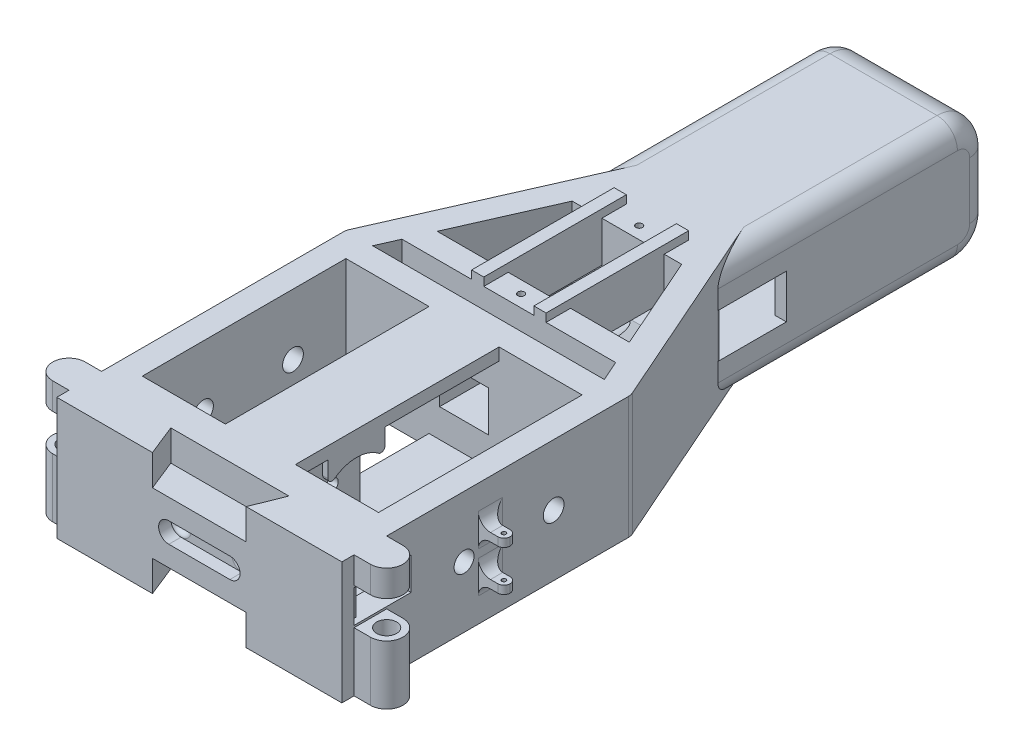
from build123d import *

# Parameters (mm, degrees)
SKETCH1_W             = 58
SKETCH1_H             = 65
BOSS_EXTRUDE1_DEPTH   = 30
BOSS_EXTRUDE3_REACH   = 92.09
SKETCH10_W            = 5
SKETCH10_H            = 14
CUT_EXTRUDE1_REACH    = 111.372
SKETCH2_R             = 2.45
SKETCH2_R_2           = 2.55
CUT_EXTRUDE2_REACH    = 91.744
SKETCH3_W             = 12
SKETCH3_H             = 10
SKETCH11_W            = 3
SKETCH11_H            = 2
BOSS_EXTRUDE4_DEPTH   = 6.3
FILLET3_R             = 1.5
SKETCH12_R            = 0.5
CUT_EXTRUDE3_DEPTH    = 92.15338732
FILLET3_OF_MIRROR1_R  = 1.5
BOSS_EXTRUDE5_REACH   = 111.564
SKETCH13_W            = 15
SKETCH13_H            = 6
BOSS_EXTRUDE6_REACH   = 111.564
SKETCH17_W            = 15
SKETCH17_H            = 14
CUT_EXTRUDE18_REACH   = 129.651
SKETCH35_W            = 16
SKETCH35_H            = 6
FILLET5_R             = 3
BOSS_EXTRUDE7_START   = 20
BOSS_EXTRUDE7_DEPTH   = 10
BOSS_EXTRUDE8_DEPTH   = 20
CUT_EXTRUDE15_REACH   = 95.637
SKETCH28_R            = 0.8
FILLET4_R             = 3
CUT_EXTRUDE16_REACH   = 96.767
SKETCH29_R            = 1.6
SKETCH30_W            = 14
SKETCH30_H            = 1.5
BOSS_EXTRUDE9_DEPTH   = 6.1
SKETCH31_W            = 1.3
SKETCH31_H            = 14
BOSS_EXTRUDE10_DEPTH  = 5
CUT_EXTRUDE17_REACH   = 99.736
FILLET11_R            = 1
FILLET11_OF_MIRROR4_R = 1
MIRROR5_START         = 2.5
MIRROR5_OUTLINE_W     = 1.5
MIRROR5_OUTLINE_H     = 14
MIRROR5_DEPTH         = 6.1
MIRROR5_START_2       = 7.3
MIRROR5_2_DEPTH       = 1.3
SKETCH36_W            = 22
SKETCH36_H            = 15
BOSS_EXTRUDE12_DEPTH  = 14
CUT_EXTRUDE19_DEPTH   = 3
CUT_EXTRUDE20_DEPTH   = 11
CUT_EXTRUDE21_REACH   = 100.983
SKETCH41_W            = 3
SKETCH41_H            = 35
BOSS_EXTRUDE13_DEPTH  = 2
BOSS_EXTRUDE14_START  = -1.789079
SKETCH43_W            = 36.284482562
SKETCH43_H            = 9.6
BOSS_EXTRUDE14_DEPTH  = 66.789079
BOSS_EXTRUDE15_REACH  = 152.996
SKETCH44_W            = 2.842240903
SKETCH44_H            = 50
FILLET6_R             = 8
FILLET7_R             = 5
SKETCH45_W            = 17
SKETCH45_H            = 8
CUT_EXTRUDE22_DEPTH   = 166.644015889
BOSS_EXTRUDE16_REACH  = 152.29
SKETCH46_W            = 4.5
SKETCH46_H            = 5
BOSS_EXTRUDE17_START  = -30
BOSS_EXTRUDE17_DEPTH  = 30
SKETCH49_W            = 8
SKETCH49_H            = 9
CUT_EXTRUDE23_DEPTH   = 8
SKETCH50_R            = 2.45
CUT_EXTRUDE24_DEPTH   = 4.5
CUT_EXTRUDE25_START   = 13.5
SKETCH51_R            = 2.45
CUT_EXTRUDE25_DEPTH   = 4.5
BOSS_EXTRUDE18_REACH  = 165.708
SKETCH53_W            = 5
SKETCH53_H            = 10
SKETCH55_W            = 58
SKETCH55_H            = 10
BOSS_EXTRUDE20_DEPTH  = 4
CUT_EXTRUDE9_START    = -10
SKETCH19_W            = 30
SKETCH19_H            = 15
CUT_EXTRUDE9_DEPTH    = 10
SKETCH58_W            = 70
SKETCH58_H            = 9
CUT_EXTRUDE27_DEPTH   = 153.77843439
BOSS_EXTRUDE22_REACH  = 153.411
SKETCH59_W            = 30
SKETCH59_H            = 5
CUT_EXTRUDE28_REACH   = 183.113
SKETCH18_R            = 1.5
FILLET9_R             = 2
FILLET10_R            = 1
SKETCH60_W            = 70
SKETCH60_H            = 3
BOSS_EXTRUDE23_DEPTH  = 30
CUT_EXTRUDE29_DEPTH   = 7.5
CUT_EXTRUDE30_DEPTH   = 3
SKETCH64_W            = 58
SKETCH64_H            = 4
BOSS_EXTRUDE24_DEPTH  = 6
CUT_EXTRUDE31_DEPTH   = 7.5


# Read off the part's stored shape, not the designer's step: Mirror5
# Some blends are built 0.0001 mm under size
with BuildPart() as part:
    # Sketch1 → Boss-Extrude1 (new body)
    with BuildSketch(Plane(origin=(0, 0, 0), x_dir=(1, 0, 0), z_dir=(0, 1, 0))):
        Polygon((-35, 38.5), (-17.352941176, 78.5), (17.352941947, 78.5), (35, 38.5), (35, -38.5), (-35, -38.5), align=None)
        Rectangle(SKETCH1_W, SKETCH1_H, mode=Mode.SUBTRACT)
        Polygon((-28.44203382, 38.5), (28.442033867, 38.5), (13.442034522, 72.5), (-13.44203382, 72.5), align=None, mode=Mode.SUBTRACT)
    extrude(amount=BOSS_EXTRUDE1_DEPTH)

    # Sketch7 → Loft3 section 0
    with BuildSketch(Plane.XY.offset(-32.5)):
        with BuildLine():
            Line((-8.6, 30), (8.6, 30))
            Line((8.6, 30), (8.6, 27))
            Line((8.6, 27), (-8.6, 27))
            Line((-8.6, 27), (-8.6, 30))
        make_face()
    # Sketch8 → Loft3 section 1
    with BuildSketch(Plane.XY.offset(38.5)):
        with BuildLine():
            Line((-8.6, 30), (8.6, 30))
            Line((8.6, 30), (8.6, 27))
            Line((8.6, 27), (-8.6, 27))
            Line((-8.6, 27), (-8.6, 30))
        make_face()
    loft3 = loft()

    # Mirror3: Loft3 across plane
    add(loft3.mirror(Plane(origin=(0, 15, 0), x_dir=(0, 0, 1), z_dir=(0, -1, 0))))

    # Sketch10 → Boss-Extrude3 (add, up to next)
    with BuildSketch(Plane.XZ.offset(-27), mode=Mode.PRIVATE) as boss_extrude3_sk1:
        with Locations((0, 2.5)):
            Rectangle(SKETCH10_W, SKETCH10_H)
    boss_extrude3_tool1 = extrude(boss_extrude3_sk1.sketch, amount=BOSS_EXTRUDE3_REACH, mode=Mode.PRIVATE) - part.part
    add(boss_extrude3_tool1.solids().sort_by_distance((0, 27, 2.5))[0])

    # Sketch2 → Cut-Extrude1 (cut, up to next)
    with BuildSketch(Plane(origin=(35, 0, 0), x_dir=(0, 0, -1), z_dir=(1, 0, 0)), mode=Mode.PRIVATE) as cut_extrude1_sk1:
        with Locations((-2.5, 15)):
            Circle(SKETCH2_R)
    cut_extrude1_tool1 = extrude(cut_extrude1_sk1.sketch, amount=-CUT_EXTRUDE1_REACH, mode=Mode.PRIVATE) & part.part
    # Sketch2 → Cut-Extrude1 (cut, up to next)
    with BuildSketch(Plane(origin=(35, 0, 0), x_dir=(0, 0, -1), z_dir=(1, 0, 0)), mode=Mode.PRIVATE) as cut_extrude1_sk2:
        with Locations((19.5, 15)):
            Circle(SKETCH2_R_2)
    cut_extrude1_tool2 = extrude(cut_extrude1_sk2.sketch, amount=-CUT_EXTRUDE1_REACH, mode=Mode.PRIVATE) & part.part
    cut_extrude1_1 = cut_extrude1_tool1.solids().sort_by_distance((35, 15, 2.5))[0]
    add(cut_extrude1_1, mode=Mode.SUBTRACT)
    cut_extrude1_2 = cut_extrude1_tool2.solids().sort_by_distance((35, 15, -19.5))[0]
    add(cut_extrude1_2, mode=Mode.SUBTRACT)
    cut_extrude1 = cut_extrude1_1 + cut_extrude1_2  # Cut-Extrude1 as one shape, for the pattern or mirror that repeats it

    # Sketch3 → Cut-Extrude2 (cut, up to next)
    with BuildSketch(Plane(origin=(0, 0, -38.5), x_dir=(-1, 0, 0), z_dir=(0, 0, -1)), mode=Mode.PRIVATE) as cut_extrude2_sk1:
        with Locations((0, 15)):
            Rectangle(SKETCH3_W, SKETCH3_H)
    cut_extrude2_tool1 = extrude(cut_extrude2_sk1.sketch, amount=-CUT_EXTRUDE2_REACH, mode=Mode.PRIVATE) & part.part
    add(cut_extrude2_tool1.solids().sort_by_distance((0, 15, -38.5))[0], mode=Mode.SUBTRACT)

    # Sketch11 → Boss-Extrude4 (add)
    with BuildSketch(Plane(origin=(35, 0, 0), x_dir=(0, 0, -1), z_dir=(1, 0, 0))):
        with Locations((2.5, 20)):
            Rectangle(SKETCH11_W, SKETCH11_H)
        with Locations((2.5, 10)):
            Rectangle(SKETCH11_W, SKETCH11_H)
    boss_extrude4 = extrude(amount=BOSS_EXTRUDE4_DEPTH)

    # Fillet3
    fillet3_edges = [part.edges().sort_by_distance(p)[0] for p in [
        (41.3, 10, -1),
        (41.3, 10, -4),
        (41.3, 20, -1),
        (41.3, 20, -4),
    ]]
    fillet(fillet3_edges, radius=FILLET3_R - 0.0001)  # a hair under: the kernel refuses the full size

    # Sketch12 → Cut-Extrude3 (cut, through all)
    with BuildSketch(Plane(origin=(0, 21, 0), x_dir=(1, 0, 0), z_dir=(0, 1, 0))):
        with Locations(Location((39.8, 2.5, 0), (0, 0, 270))):
            Circle(SKETCH12_R)
    cut_extrude3 = extrude(amount=-CUT_EXTRUDE3_DEPTH, mode=Mode.SUBTRACT)

    # Mirror1: Cut-Extrude1, Boss-Extrude4, Cut-Extrude3 across plane
    add(cut_extrude1.mirror(Plane(origin=(0, 0, 0), x_dir=(0, 0, 1), z_dir=(1, 0, 0))), mode=Mode.SUBTRACT)
    add(boss_extrude4.mirror(Plane(origin=(0, 0, 0), x_dir=(0, 0, 1), z_dir=(1, 0, 0))))
    add(cut_extrude3.mirror(Plane(origin=(0, 0, 0), x_dir=(0, 0, 1), z_dir=(1, 0, 0))), mode=Mode.SUBTRACT)

    # Fillet3 of Mirror1
    fillet3_of_mirror1_edges = [part.edges().sort_by_distance(p)[0] for p in [
        (-41.3, 10, -1),
        (-41.3, 10, -4),
        (-41.3, 20, -1),
        (-41.3, 20, -4),
    ]]
    fillet(fillet3_of_mirror1_edges, radius=FILLET3_OF_MIRROR1_R - 0.0001)  # a hair under: the kernel refuses the full size

    # Sketch13 → Boss-Extrude5 (add, up to next)
    with BuildSketch(Plane(origin=(-29, 0, 0), x_dir=(0, 0, -1), z_dir=(1, 0, 0)), mode=Mode.PRIVATE) as boss_extrude5_sk1:
        with Locations((-25, 27)):
            Rectangle(SKETCH13_W, SKETCH13_H)
    boss_extrude5_tool1 = extrude(boss_extrude5_sk1.sketch, amount=BOSS_EXTRUDE5_REACH, mode=Mode.PRIVATE) - part.part
    add(boss_extrude5_tool1.solids().sort_by_distance((-29, 27, 25))[0])

    # Sketch17 → Boss-Extrude6 (add, up to next)
    with BuildSketch(Plane(origin=(-29, 0, 0), x_dir=(0, 0, -1), z_dir=(1, 0, 0)), mode=Mode.PRIVATE) as boss_extrude6_sk1:
        with Locations((-25, 7)):
            Rectangle(SKETCH17_W, SKETCH17_H)
    boss_extrude6_tool1 = extrude(boss_extrude6_sk1.sketch, amount=BOSS_EXTRUDE6_REACH, mode=Mode.PRIVATE) - part.part
    add(boss_extrude6_tool1.solids().sort_by_distance((-29, 7, 25))[0])

    # Sketch35 → Cut-Extrude18 (cut, up to next)
    with BuildSketch(Plane(origin=(0, 0, -78.5), x_dir=(-1, 0, 0), z_dir=(0, 0, -1)), mode=Mode.PRIVATE) as cut_extrude18_sk1:
        with Locations((0, 15)):
            Rectangle(SKETCH35_W, SKETCH35_H)
    cut_extrude18_tool1 = extrude(cut_extrude18_sk1.sketch, amount=-CUT_EXTRUDE18_REACH, mode=Mode.PRIVATE) & part.part
    add(cut_extrude18_tool1.solids().sort_by_distance((0, 15, -78.5))[0], mode=Mode.SUBTRACT)

    # Fillet5
    fillet5_edges = [part.edges().sort_by_distance(p)[0] for p in [
        (-35, 15, -38.5),
        (-17.352941176, 15, -78.5),
        (17.352941947, 15, -78.5),
        (35, 15, -38.5),
        (-8, 15, -78.5),
        (8, 15, -78.5),
    ]]
    fillet(fillet5_edges, radius=FILLET5_R)

    # Sketch24 → Boss-Extrude7 (add)
    with BuildSketch(Plane(origin=(0, 0, 0), x_dir=(1, 0, 0), z_dir=(0, 1, 0)).offset(BOSS_EXTRUDE7_START)):
        Polygon((9.15, 49.5), (9.15, 72.5), (6.15, 72.5), (6.15, 49.5), (-6.15, 49.5), (-6.15, 72.5), (-9.15, 72.5), (-9.15, 49.5), (-23.589092644, 49.5), (-26.23615161, 43.5), (26.23615161, 43.5), (23.589092902, 49.5), align=None)
    extrude(amount=BOSS_EXTRUDE7_DEPTH)

    # Sketch26 → Boss-Extrude8 (add)
    with BuildSketch(Plane(origin=(0, 0, -38.5), x_dir=(-1, 0, 0), z_dir=(0, 0, -1))):
        Polygon((-11, 5), (-11, 0), (11, 0), (11, 5), (11, 15), (6, 15), (6, 10), (-6, 10), (-6, 15), (-11, 15), align=None)
    extrude(amount=BOSS_EXTRUDE8_DEPTH)

    # Sketch28 → Cut-Extrude15 (cut, up to next)
    with BuildSketch(Plane(origin=(0, 30, 0), x_dir=(-1, 0, 0), z_dir=(0, 1, 0)), mode=Mode.PRIVATE) as cut_extrude15_sk1:
        with Locations(Location((0, -46.5, 0), (0, 0, 90))):
            Circle(SKETCH28_R)
    cut_extrude15_tool1 = extrude(cut_extrude15_sk1.sketch, amount=-CUT_EXTRUDE15_REACH, mode=Mode.PRIVATE) & part.part
    # Sketch28 → Cut-Extrude15 (cut, up to next)
    with BuildSketch(Plane(origin=(0, 30, 0), x_dir=(-1, 0, 0), z_dir=(0, 1, 0)), mode=Mode.PRIVATE) as cut_extrude15_sk2:
        with Locations(Location((0, -75.5, 0), (0, 0, 90))):
            Circle(SKETCH28_R)
    cut_extrude15_tool2 = extrude(cut_extrude15_sk2.sketch, amount=-CUT_EXTRUDE15_REACH, mode=Mode.PRIVATE) & part.part
    add(cut_extrude15_tool1.solids().sort_by_distance((0, 30, -46.5))[0], mode=Mode.SUBTRACT)
    add(cut_extrude15_tool2.solids().sort_by_distance((0, 30, -75.5))[0], mode=Mode.SUBTRACT)

    # Fillet4
    fillet4_edges = [part.edges().sort_by_distance(p)[0] for p in [
        (35, 19, -2.5),
        (35, 20, -4),
        (35, 21, -2.5),
        (35, 11, -2.5),
        (35, 9, -2.5),
        (35, 10, -4),
        (-35, 19, -2.5),
        (-35, 20, -4),
        (-35, 21, -2.5),
        (-35, 11, -2.5),
        (-35, 9, -2.5),
        (-35, 10, -4),
    ]]
    fillet(fillet4_edges, radius=FILLET4_R)

    # Sketch29 → Cut-Extrude16 (cut, up to next)
    with BuildSketch(Plane(origin=(2.5, 0, 0), x_dir=(0, 0, -1), z_dir=(1, 0, 0)), mode=Mode.PRIVATE) as cut_extrude16_sk1:
        with Locations(Location((-2.5, 15, 0), (0, 0, 90))):
            Circle(SKETCH29_R)
    cut_extrude16_tool1 = extrude(cut_extrude16_sk1.sketch, amount=-CUT_EXTRUDE16_REACH, mode=Mode.PRIVATE) & part.part
    add(cut_extrude16_tool1.solids().sort_by_distance((2.5, 15, 2.5))[0], mode=Mode.SUBTRACT)

    # Sketch30 → Boss-Extrude9 (add)
    with BuildSketch(Plane.ZY.offset(2.5)):
        with Locations((2.5, 26.25)):
            Rectangle(SKETCH30_W, SKETCH30_H)
    boss_extrude9 = extrude(amount=BOSS_EXTRUDE9_DEPTH)

    # Sketch31 → Boss-Extrude10 (add)
    with BuildSketch(Plane.XZ.offset(-25.5)):
        with Locations((-7.95, 2.5)):
            Rectangle(SKETCH31_W, SKETCH31_H)
    boss_extrude10 = extrude(amount=BOSS_EXTRUDE10_DEPTH)

    # Sketch32 → Cut-Extrude17 (cut, up to next)
    with BuildSketch(Plane.ZY.offset(8.6), mode=Mode.PRIVATE) as cut_extrude17_sk1:
        with BuildLine():
            Line((-4.5, 20.5), (-4.5, 20.656854249))
            ThreePointArc((-4.5, 20.656854249), (2.5, 24), (9.5, 20.656854249))
            Line((9.5, 20.656854249), (9.5, 20.5))
            Line((9.5, 20.5), (-4.5, 20.5))
        make_face()
    cut_extrude17_tool1 = extrude(cut_extrude17_sk1.sketch, amount=-CUT_EXTRUDE17_REACH, mode=Mode.PRIVATE) & part.part
    cut_extrude17 = cut_extrude17_tool1.solids().sort_by_distance((-8.6, 21.927092, 2.5))[0]
    add(cut_extrude17, mode=Mode.SUBTRACT)

    # Fillet11
    fillet11_edges = [part.edges().sort_by_distance(p)[0] for p in [
        (-7.95, 20.656854249, 9.5),
        (-7.95, 20.656854249, -4.5),
    ]]
    fillet(fillet11_edges, radius=FILLET11_R)

    # Mirror4: Boss-Extrude9, Boss-Extrude10, Cut-Extrude17 across plane
    add(boss_extrude9.mirror(Plane(origin=(0, 15, 0), x_dir=(0, 0, 1), z_dir=(0, -1, 0))))
    add(boss_extrude10.mirror(Plane(origin=(0, 15, 0), x_dir=(0, 0, 1), z_dir=(0, -1, 0))))
    add(cut_extrude17.mirror(Plane(origin=(0, 15, 0), x_dir=(0, 0, 1), z_dir=(0, -1, 0))), mode=Mode.SUBTRACT)

    # Fillet11 of Mirror4
    fillet11_of_mirror4_edges = [part.edges().sort_by_distance(p)[0] for p in [
        (-7.95, 9.343145751, 9.5),
        (-7.95, 9.343145751, -4.5),
    ]]
    fillet(fillet11_of_mirror4_edges, radius=FILLET11_OF_MIRROR4_R)

    # Mirror5 outline → Mirror5 (add)
    with BuildSketch(Plane.YZ.offset(MIRROR5_START)):
        with Locations((3.75, 2.5)):
            Rectangle(MIRROR5_OUTLINE_W, MIRROR5_OUTLINE_H)
        with Locations((26.25, 2.5)):
            Rectangle(MIRROR5_OUTLINE_W, MIRROR5_OUTLINE_H)
    extrude(amount=MIRROR5_DEPTH)

    # Mirror5 2 outline → Mirror5 2 (add)
    with BuildSketch(Plane.YZ.offset(MIRROR5_START_2)):
        with BuildLine():
            Line((7, 9.5), (4.5, 9.5))
            Line((4.5, 9.5), (4.5, -4.5))
            Line((4.5, -4.5), (7, -4.5))
            ThreePointArc((7, -4.5), (7.894427191, -3.947213595), (7.8, -2.9))
            ThreePointArc((7.8, -2.9), (6, 2.5), (7.8, 7.9))
            ThreePointArc((7.8, 7.9), (7.894427191, 8.947213595), (7, 9.5))
        make_face()
        with BuildLine():
            Line((25.5, 9.5), (23, 9.5))
            ThreePointArc((23, 9.5), (22.105572809, 8.947213595), (22.2, 7.9))
            ThreePointArc((22.2, 7.9), (24, 2.5), (22.2, -2.9))
            ThreePointArc((22.2, -2.9), (22.105572809, -3.947213595), (23, -4.5))
            Line((23, -4.5), (25.5, -4.5))
            Line((25.5, -4.5), (25.5, 9.5))
        make_face()
    extrude(amount=MIRROR5_2_DEPTH)

    # Sketch36 → Boss-Extrude12 (add)
    with BuildSketch(Plane(origin=(0, 0, -58.5), x_dir=(-1, 0, 0), z_dir=(0, 0, -1))):
        with Locations((0, 7.5)):
            Rectangle(SKETCH36_W, SKETCH36_H)
    extrude(amount=BOSS_EXTRUDE12_DEPTH)

    # Sketch37 → Cut-Extrude19 (cut)
    with BuildSketch(Plane.XY.offset(-58.5)):
        with BuildLine():
            Line((-6, 15), (6, 15))
            ThreePointArc((6, 15), (5.340169944, 12.204915028), (3.5, 10))
            Line((3.5, 10), (-3.5, 10))
            ThreePointArc((-3.5, 10), (-5.340169944, 12.204915028), (-6, 15))
        make_face()
    extrude(amount=-CUT_EXTRUDE19_DEPTH, mode=Mode.SUBTRACT)

    # Sketch38 → Cut-Extrude20 (cut)
    with BuildSketch(Plane.XY.offset(-61.5)):
        with BuildLine():
            Line((-6, 15), (6, 15))
            ThreePointArc((6, 15), (0, 12), (-6, 15))
        make_face()
    extrude(amount=-CUT_EXTRUDE20_DEPTH, mode=Mode.SUBTRACT)

    # Cut-Extrude21: up to this face of the body (flat: up to its plane)
    cut_extrude21_end = Plane(part.part.faces().sort_by_distance((11, 7.5, -55.5))[0])
    # Sketch40 → Cut-Extrude21 (cut, up to the picked face)
    with BuildSketch(Plane.ZY.offset(11), mode=Mode.PRIVATE) as cut_extrude21_sk1:
        Polygon((-58.5, 15), (-72.5, 15), (-72.5, 12), align=None)
    cut_extrude21_tool1 = split(extrude(cut_extrude21_sk1.sketch, amount=-CUT_EXTRUDE21_REACH, mode=Mode.PRIVATE), bisect_by=cut_extrude21_end, keep=Keep.BOTH, mode=Mode.PRIVATE)
    add(cut_extrude21_tool1.solids().sort_by(Axis((-11, 14, -67.833333), (1, 0, 0)))[0], mode=Mode.SUBTRACT)

    # Sketch41 → Boss-Extrude13 (add)
    with BuildSketch(Plane(origin=(0, 30, 0), x_dir=(1, 0, 0), z_dir=(0, 1, 0))):
        with Locations((-7.65, 61)):
            Rectangle(SKETCH41_W, SKETCH41_H)
        with Locations((7.65, 61)):
            Rectangle(SKETCH41_W, SKETCH41_H)
    extrude(amount=BOSS_EXTRUDE13_DEPTH)

    # Sketch43 → Boss-Extrude14 (add)
    with BuildSketch(Plane(origin=(0, 0, -78.5), x_dir=(-1, 0, 0), z_dir=(0, 0, -1)).offset(BOSS_EXTRUDE14_START)):
        with Locations((-3.78e-07, 4.8)):
            Rectangle(SKETCH43_W, SKETCH43_H)
        with Locations((-3.78e-07, 25.2)):
            Rectangle(SKETCH43_W, SKETCH43_H)
    extrude(amount=BOSS_EXTRUDE14_DEPTH)

    # Sketch44 → Boss-Extrude15 (add, up to next)
    with BuildSketch(Plane(origin=(0, 9.6, 0), x_dir=(1, 0, 0), z_dir=(0, 1, 0)), mode=Mode.PRIVATE) as boss_extrude15_sk1:
        with Locations((-16.721120451, 118.5)):
            Rectangle(SKETCH44_W, SKETCH44_H)
    boss_extrude15_tool1 = extrude(boss_extrude15_sk1.sketch, amount=BOSS_EXTRUDE15_REACH, mode=Mode.PRIVATE) - part.part
    # Sketch44 → Boss-Extrude15 (add, up to next)
    with BuildSketch(Plane(origin=(0, 9.6, 0), x_dir=(1, 0, 0), z_dir=(0, 1, 0)), mode=Mode.PRIVATE) as boss_extrude15_sk2:
        Polygon((18.142241659, 143.5), (15.3, 143.5), (15.3, 93.5), (18.142240903, 93.5), align=None)
    boss_extrude15_tool2 = extrude(boss_extrude15_sk2.sketch, amount=BOSS_EXTRUDE15_REACH, mode=Mode.PRIVATE) - part.part
    add(boss_extrude15_tool1.solids().sort_by_distance((-16.72112, 9.6, -118.5))[0])
    add(boss_extrude15_tool2.solids().sort_by_distance((16.721121, 9.6, -118.500001))[0])

    # Fillet6
    fillet6_edges = [part.edges().sort_by_distance(p)[0] for p in [
        (3.78e-07, 0, -143.5),
        (3.78e-07, 30, -143.5),
    ]]
    fillet(fillet6_edges, radius=FILLET6_R)

    # Fillet7
    # the kernel refuses this fillet: 5 mm, written as the material it takes off along each edge
    with BuildSketch(Plane(origin=(18.142241659, 0, -64.210921), x_dir=(-1, 0, 0), z_dir=(0, 0, -1))) as fillet7_piece_1_section:
        with BuildLine():
            CenterArc((FILLET7_R, FILLET7_R), FILLET7_R, 180, 90)
            Line((0, FILLET7_R), (0, 0))
            Line((0, 0), (FILLET7_R, 0))
        make_face()
    fillet7_piece_1 = extrude(amount=71.289079, mode=Mode.PRIVATE)
    fillet7_piece_1 = split(fillet7_piece_1, bisect_by=Plane(origin=(6.655944686, 1.159648817, -102.746528186), z_dir=(0.9149178080838143, 0, -0.4036401918182936)), keep=Keep.TOP, mode=Mode.PRIVATE)
    with BuildSketch(Plane(origin=(18.142241659, 8, -135.5), x_dir=(0, -1, 0), z_dir=(0, 0, 1))) as fillet7_piece_2:
        with BuildLine():
            CenterArc((8 - FILLET7_R, -FILLET7_R), FILLET7_R, 0, 90)
            Line((8 - FILLET7_R, 0), (8, 0))
            Line((8, 0), (8, -FILLET7_R))
        make_face()
    fillet7_piece_2_solid = revolve(axis=Axis((18.142241659, 8, -135.5), (1, 0, 0)), revolution_arc=90, mode=Mode.PRIVATE)
    with BuildSketch(Plane(origin=(18.142241659, 9.6, -143.5), x_dir=(-1, 0, 0), z_dir=(0, 1, 0))) as fillet7_piece_3:
        with BuildLine():
            CenterArc((FILLET7_R * 1.00000001512, FILLET7_R), FILLET7_R, 179.999999134, 90.000000866)
            Line((FILLET7_R * 1.511713279e-08, FILLET7_R * 1.00000001512), (0, 0))
            Line((0, 0), (FILLET7_R * 1.00000001512, 0))
        make_face()
    fillet7_piece_3_solid = extrude(amount=10.8, mode=Mode.PRIVATE)
    with BuildSketch(Plane(origin=(18.142241659, 22, -135.5), x_dir=(0, 1, 0), z_dir=(0, 0, 1))) as fillet7_piece_4:
        with BuildLine():
            CenterArc((8 - FILLET7_R, FILLET7_R), FILLET7_R, 270, 90)
            Line((8 - FILLET7_R, 0), (8, 0))
            Line((8, 0), (8, FILLET7_R))
        make_face()
    fillet7_piece_4_solid = revolve(axis=Axis((18.142241659, 22, -135.5), (-1, 0, 0)), revolution_arc=90, mode=Mode.PRIVATE)
    with BuildSketch(Plane(origin=(-18.142240903, 0, -64.210921), x_dir=(0, 1, 0), z_dir=(0, 0, -1))) as fillet7_piece_5_section:
        with BuildLine():
            CenterArc((FILLET7_R, FILLET7_R), FILLET7_R, 180, 90)
            Line((0, FILLET7_R), (0, 0))
            Line((0, 0), (FILLET7_R, 0))
        make_face()
    fillet7_piece_5 = extrude(amount=71.289079, mode=Mode.PRIVATE)
    fillet7_piece_5 = split(fillet7_piece_5, bisect_by=Plane(origin=(-6.655943611, 1.159648816, -102.746527816), z_dir=(-0.914917801572932, 0, -0.40364020657629374)), keep=Keep.TOP, mode=Mode.PRIVATE)
    with BuildSketch(Plane(origin=(-18.142240903, 8, -135.5), x_dir=(0, -1, 0), z_dir=(0, 0, 1))) as fillet7_piece_6:
        with BuildLine():
            CenterArc((8 - FILLET7_R, FILLET7_R), FILLET7_R, 270, 90)
            Line((8, FILLET7_R), (8, 0))
            Line((8, 0), (8 - FILLET7_R, 0))
        make_face()
    fillet7_piece_6_solid = revolve(axis=Axis((-18.142240903, 8, -135.5), (1, 0, 0)), revolution_arc=90, mode=Mode.PRIVATE)
    with BuildSketch(Plane(origin=(-18.142240903, 22, -143.5), x_dir=(0, 0, 1), z_dir=(0, -1, 0))) as fillet7_piece_7:
        with BuildLine():
            CenterArc((FILLET7_R, -FILLET7_R), FILLET7_R, 90, 90)
            Line((0, -FILLET7_R), (0, 0))
            Line((0, 0), (FILLET7_R, 0))
        make_face()
    fillet7_piece_7_solid = extrude(amount=14, mode=Mode.PRIVATE)
    with BuildSketch(Plane(origin=(-18.142240903, 22, -135.5), x_dir=(0, 1, 0), z_dir=(0, 0, 1))) as fillet7_piece_8:
        with BuildLine():
            CenterArc((8 - FILLET7_R, -FILLET7_R), FILLET7_R, 0, 90)
            Line((8, -FILLET7_R), (8, 0))
            Line((8, 0), (8 - FILLET7_R, 0))
        make_face()
    fillet7_piece_8_solid = revolve(axis=Axis((-18.142240903, 22, -135.5), (-1, 0, 0)), revolution_arc=90, mode=Mode.PRIVATE)
    with BuildSketch(Plane(origin=(18.142241659, 30, -64.210921), x_dir=(-1, 0, 0), z_dir=(0, 0, -1))) as fillet7_piece_9_section:
        with BuildLine():
            CenterArc((FILLET7_R, -FILLET7_R), FILLET7_R, 90, 90)
            Line((0, -FILLET7_R), (0, 0))
            Line((0, 0), (FILLET7_R, 0))
        make_face()
    fillet7_piece_9 = extrude(amount=71.289079, mode=Mode.PRIVATE)
    fillet7_piece_9 = split(fillet7_piece_9, bisect_by=Plane(origin=(6.655944686, 28.840351183, -102.746528186), z_dir=(0.9149178080838143, 0, -0.4036401918182936)), keep=Keep.TOP, mode=Mode.PRIVATE)
    with BuildSketch(Plane(origin=(-18.142240903, 30, -64.210921), x_dir=(1, 0, 0), z_dir=(0, 0, -1))) as fillet7_piece_10_section:
        with BuildLine():
            CenterArc((FILLET7_R, FILLET7_R), FILLET7_R, 180, 90)
            Line((0, FILLET7_R), (0, 0))
            Line((0, 0), (FILLET7_R, 0))
        make_face()
    fillet7_piece_10 = extrude(amount=71.289079, mode=Mode.PRIVATE)
    fillet7_piece_10 = split(fillet7_piece_10, bisect_by=Plane(origin=(-6.655943611, 28.840351184, -102.746527816), z_dir=(-0.914917801572932, 0, -0.40364020657629374)), keep=Keep.TOP, mode=Mode.PRIVATE)
    with BuildSketch(Plane(origin=(18.142241659, 20.4, -143.5), x_dir=(0, 0, 1), z_dir=(0, 1, 0)), Plane(origin=(18.142241659, 9.6, -143.5), x_dir=(-1, 0, 0), z_dir=(0, -1, 0))) as fillet7_piece_11:
        with BuildLine():
            CenterArc((FILLET7_R, -FILLET7_R), FILLET7_R, 90, 90)
            Line((0, -FILLET7_R), (0, 0))
            Line((0, 0), (FILLET7_R, 0))
        make_face()
    fillet7_piece_11_solid = extrude(amount=1.6, mode=Mode.PRIVATE)
    add([fillet7_piece_1, fillet7_piece_2_solid, fillet7_piece_3_solid, fillet7_piece_4_solid, fillet7_piece_5, fillet7_piece_6_solid, fillet7_piece_7_solid, fillet7_piece_8_solid, fillet7_piece_9, fillet7_piece_10, fillet7_piece_11_solid], mode=Mode.SUBTRACT)

    # Sketch45 → Cut-Extrude22 (cut, through all)
    with BuildSketch(Plane(origin=(35, 0, 0), x_dir=(0, 0, -1), z_dir=(1, 0, 0))):
        with Locations((-24, 19)):
            Rectangle(SKETCH45_W, SKETCH45_H)
    extrude(amount=-CUT_EXTRUDE22_DEPTH, mode=Mode.SUBTRACT)

    # Sketch46 → Boss-Extrude16 (add, up to next)
    with BuildSketch(Plane(origin=(0, 15, 0), x_dir=(1, 0, 0), z_dir=(0, 1, 0)), mode=Mode.PRIVATE) as boss_extrude16_sk1:
        with Locations((31.25, -30)):
            Rectangle(SKETCH46_W, SKETCH46_H)
    boss_extrude16_tool1 = extrude(boss_extrude16_sk1.sketch, amount=BOSS_EXTRUDE16_REACH, mode=Mode.PRIVATE) - part.part
    boss_extrude16 = boss_extrude16_tool1.solids().sort_by_distance((31.25, 15, 30))[0]
    add(boss_extrude16)

    # Sketch48 → Boss-Extrude17 (add)
    with BuildSketch(Plane.XZ.offset(BOSS_EXTRUDE17_START)):
        with BuildLine():
            Line((35, 29.5), (39, 29.5))
            ThreePointArc((39, 29.5), (43, 25.5), (39, 21.5))
            Line((39, 21.5), (35, 21.5))
            Line((35, 21.5), (35, 29.5))
        make_face()
    boss_extrude17 = extrude(amount=BOSS_EXTRUDE17_DEPTH)

    # Sketch49 → Cut-Extrude23 (cut)
    with BuildSketch(Plane.XY.offset(29.5)):
        with Locations((39, 19)):
            Rectangle(SKETCH49_W, SKETCH49_H)
    cut_extrude23 = extrude(amount=-CUT_EXTRUDE23_DEPTH, mode=Mode.SUBTRACT)

    # Sketch50 → Cut-Extrude24 (cut)
    with BuildSketch(Plane(origin=(0, 14.5, 0), x_dir=(1, 0, 0), z_dir=(0, 1, 0))):
        with Locations(Location((39, -25.5, 0), (0, 0, 270))):
            Circle(SKETCH50_R)
    cut_extrude24 = extrude(amount=-CUT_EXTRUDE24_DEPTH, mode=Mode.SUBTRACT)

    # Sketch51 → Cut-Extrude25 (cut)
    with BuildSketch(Plane(origin=(0, 14.5, 0), x_dir=(1, 0, 0), z_dir=(0, 1, 0)).offset(CUT_EXTRUDE25_START)):
        with Locations(Location((39, -25.5, 0), (0, 0, 270))):
            Circle(SKETCH51_R)
    cut_extrude25 = extrude(amount=-CUT_EXTRUDE25_DEPTH, mode=Mode.SUBTRACT)

    # Mirror7: Boss-Extrude16, Boss-Extrude17, Cut-Extrude23, Cut-Extrude24, Cut-Extrude25 across plane
    add(boss_extrude16.mirror(Plane(origin=(0, 0, 0), x_dir=(0, 0, 1), z_dir=(1, 0, 0))))
    add(boss_extrude17.mirror(Plane(origin=(0, 0, 0), x_dir=(0, 0, 1), z_dir=(1, 0, 0))))
    add(cut_extrude23.mirror(Plane(origin=(0, 0, 0), x_dir=(0, 0, 1), z_dir=(1, 0, 0))), mode=Mode.SUBTRACT)
    add(cut_extrude24.mirror(Plane(origin=(0, 0, 0), x_dir=(0, 0, 1), z_dir=(1, 0, 0))), mode=Mode.SUBTRACT)
    add(cut_extrude25.mirror(Plane(origin=(0, 0, 0), x_dir=(0, 0, 1), z_dir=(1, 0, 0))), mode=Mode.SUBTRACT)

    # Sketch53 → Boss-Extrude18 (add, up to next)
    with BuildSketch(Plane.ZY.offset(-29), mode=Mode.PRIVATE) as boss_extrude18_sk1:
        with Locations((30, 19)):
            Rectangle(SKETCH53_W, SKETCH53_H)
    boss_extrude18_tool1 = extrude(boss_extrude18_sk1.sketch, amount=BOSS_EXTRUDE18_REACH, mode=Mode.PRIVATE) - part.part
    add(boss_extrude18_tool1.solids().sort_by_distance((29, 19, 30))[0])

    # Sketch55 → Boss-Extrude20 (add)
    with BuildSketch(Plane(origin=(0, 0, 27.5), x_dir=(-1, 0, 0), z_dir=(0, 0, -1))):
        with Locations((0, 19)):
            Rectangle(SKETCH55_W, SKETCH55_H)
    extrude(amount=BOSS_EXTRUDE20_DEPTH)

    # Sketch19 → Cut-Extrude9 (cut)
    with BuildSketch(Plane(origin=(0, 30, 0), x_dir=(1, 0, 0), z_dir=(0, 1, 0)).offset(CUT_EXTRUDE9_START)):
        with Locations((0, -25)):
            Rectangle(SKETCH19_W, SKETCH19_H)
    extrude(amount=-CUT_EXTRUDE9_DEPTH, mode=Mode.SUBTRACT)

    # Sketch58 → Cut-Extrude27 (cut, through all)
    with BuildSketch(Plane(origin=(0, 30, 0), x_dir=(1, 0, 0), z_dir=(0, 1, 0))):
        with Locations((0, -34)):
            Rectangle(SKETCH58_W, SKETCH58_H)
    extrude(amount=-CUT_EXTRUDE27_DEPTH, mode=Mode.SUBTRACT)

    # Sketch59 → Boss-Extrude22 (add, up to next)
    with BuildSketch(Plane(origin=(0, 10, 0), x_dir=(1, 0, 0), z_dir=(0, 1, 0)), mode=Mode.PRIVATE) as boss_extrude22_sk1:
        with Locations((0, -27)):
            Rectangle(SKETCH59_W, SKETCH59_H)
    boss_extrude22_tool1 = extrude(boss_extrude22_sk1.sketch, amount=BOSS_EXTRUDE22_REACH, mode=Mode.PRIVATE) - part.part
    add(boss_extrude22_tool1.solids().sort_by_distance((0, 10, 27))[0])

    # Sketch18 → Cut-Extrude28 (cut, up to next)
    with BuildSketch(Plane.XY.offset(29.5), mode=Mode.PRIVATE) as cut_extrude28_sk1:
        with Locations((7.5, 15)):
            Circle(SKETCH18_R)
    cut_extrude28_tool1 = extrude(cut_extrude28_sk1.sketch, amount=-CUT_EXTRUDE28_REACH, mode=Mode.PRIVATE) & part.part
    # Sketch18 → Cut-Extrude28 (cut, up to next)
    with BuildSketch(Plane.XY.offset(29.5), mode=Mode.PRIVATE) as cut_extrude28_sk2:
        with Locations((-7.5, 15)):
            Circle(SKETCH18_R)
    cut_extrude28_tool2 = extrude(cut_extrude28_sk2.sketch, amount=-CUT_EXTRUDE28_REACH, mode=Mode.PRIVATE) & part.part
    add(cut_extrude28_tool1.solids().sort_by_distance((7.5, 15, 29.5))[0], mode=Mode.SUBTRACT)
    add(cut_extrude28_tool2.solids().sort_by_distance((-7.5, 15, 29.5))[0], mode=Mode.SUBTRACT)

    # Fillet9
    fillet9_edges = [part.edges().sort_by_distance(p)[0] for p in [
        (6, 15, 24.5),
        (-9, 15, 24.5),
    ]]
    fillet(fillet9_edges, radius=FILLET9_R)

    # Fillet10
    fillet10_edges = [part.edges().sort_by_distance(p)[0] for p in [
        (6, 15, 29.5),
        (-9, 15, 29.5),
    ]]
    fillet(fillet10_edges, radius=FILLET10_R)

    # Sketch60 → Boss-Extrude23 (add)
    with BuildSketch(Plane.XZ):
        with Locations((0, 31)):
            Rectangle(SKETCH60_W, SKETCH60_H)
    extrude(amount=-BOSS_EXTRUDE23_DEPTH)

    # Sketch61 → Cut-Extrude29 (cut)
    with BuildSketch(Plane.XZ):
        Polygon((11.5, 32.5), (-11.5, 32.5), (-14.5, 25), (14.5, 25), align=None)
    extrude(amount=-CUT_EXTRUDE29_DEPTH, mode=Mode.SUBTRACT)

    # Sketch62 → Cut-Extrude30 (cut)
    with BuildSketch(Plane.XY.offset(32.5)):
        with BuildLine():
            Line((-7.5, 17.5), (7.5, 17.5))
            ThreePointArc((7.5, 17.5), (10, 15), (7.5, 12.5))
            Line((7.5, 12.5), (-7.5, 12.5))
            ThreePointArc((-7.5, 12.5), (-10, 15), (-7.5, 17.5))
        make_face()
    extrude(amount=-CUT_EXTRUDE30_DEPTH, mode=Mode.SUBTRACT)

    # Sketch64 → Boss-Extrude24 (add)
    with BuildSketch(Plane(origin=(0, 0, 23.5), x_dir=(-1, 0, 0), z_dir=(0, 0, -1))):
        with Locations((0, 22)):
            Rectangle(SKETCH64_W, SKETCH64_H)
    extrude(amount=BOSS_EXTRUDE24_DEPTH)

    # Sketch63 → Cut-Extrude31 (cut)
    with BuildSketch(Plane(origin=(0, 30, 0), x_dir=(1, 0, 0), z_dir=(0, 1, 0))):
        Polygon((-11.5, -32.5), (11.5, -32.5), (14.5, -25), (-14.5, -25), align=None)
    extrude(amount=-CUT_EXTRUDE31_DEPTH, mode=Mode.SUBTRACT)


solid = part.part
